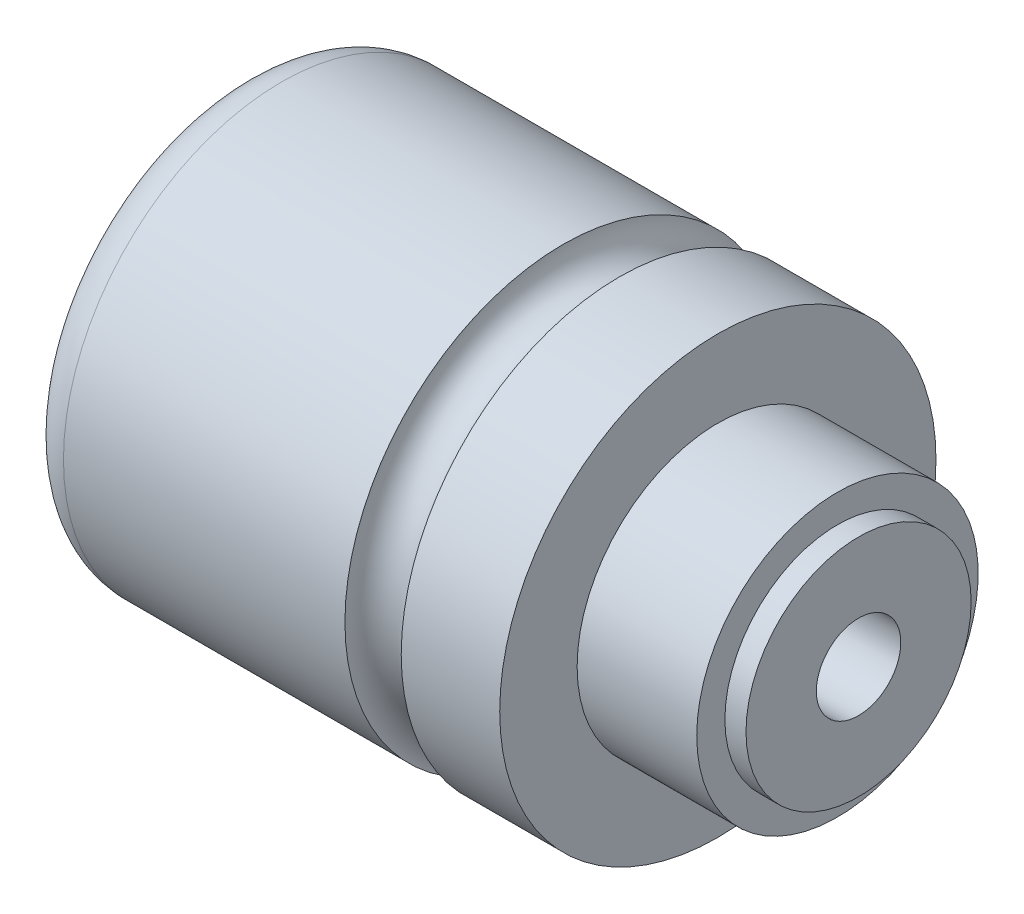
from build123d import *

# Parameters (mm, degrees)
FILLET3_R = 6


with BuildPart() as part:
    # Sketch1 → Revolve1 (revolve)
    with BuildSketch(Plane.XY, mode=Mode.PRIVATE) as revolve1_sk:
        with BuildLine():
            Line((44, 6), (44, 16))
            Line((44, 16), (41, 16))
            Line((41, 16), (41, 20))
            Line((41, 20), (24, 20))
            Line((24, 20), (24, 31))
            Line((24, 31), (10, 31))
            ThreePointArc((10, 31), (6, 27), (2, 31))
            Line((2, 31), (-44, 31))
            Line((-44, 31), (-44, 25))
            Line((-44, 25), (-42.5, 25))
            Line((-42.5, 25), (-42.5, 16))
            Line((-42.5, 16), (-32, 16))
            Line((-32, 16), (-32, 12.5))
            Line((-32, 12.5), (-29, 12.5))
            Line((-29, 12.5), (-29, 20.5))
            Line((-29, 20.5), (-22, 20.5))
            Line((-22, 20.5), (-22, 16))
            Line((-22, 16), (-14, 16))
            Line((-14, 16), (-14, 6))
            Line((-14, 6), (44, 6))
        make_face()
    revolve(revolve1_sk.sketch.rotate(Axis((-44, 0, 0), (1, 0, 0)), 90), axis=Axis((-44, 0, 0), (1, 0, 0)))

    # Fillet3
    fillet3_edges = [part.edges().sort_by_distance(p)[0] for p in [
        (-44, 0, -31),
    ]]
    fillet(fillet3_edges, radius=FILLET3_R - 0.0001)  # a hair under: the kernel refuses the full size


solid = part.part
